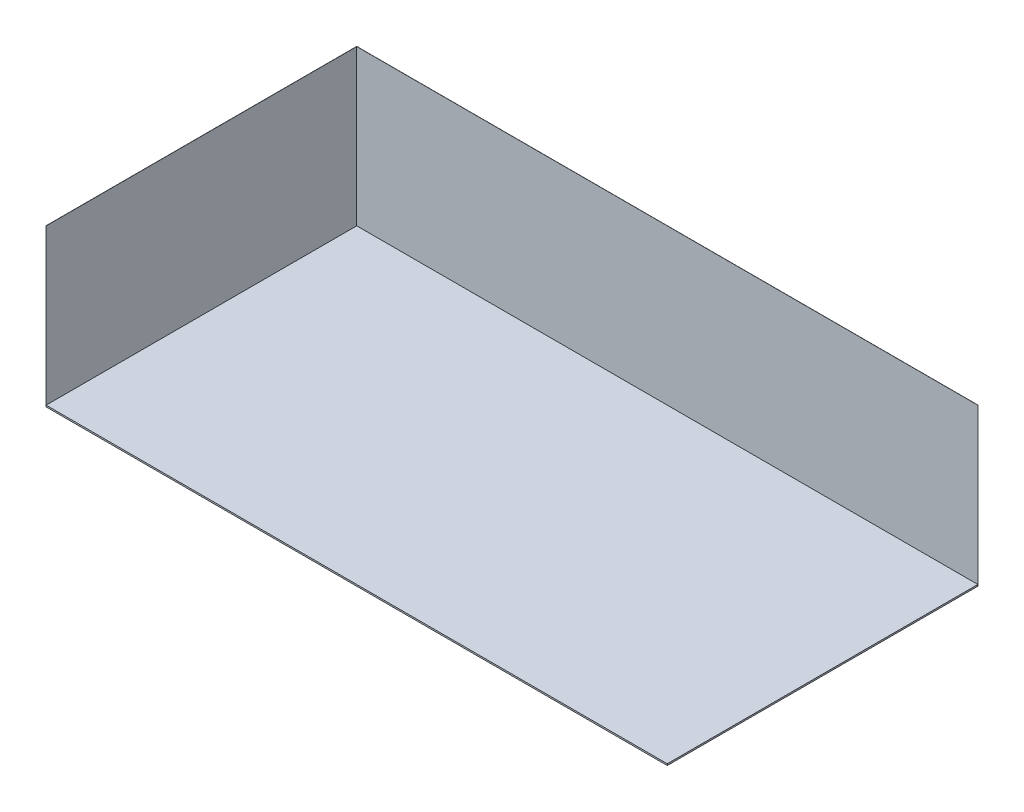
from build123d import *

# Parameters (mm, degrees)
SKETCH2_W     = 101.6
SKETCH2_H     = 50.8
FLOOR_2_DEPTH = 0.254
SKETCH3_W     = 101.6
SKETCH3_H     = 0.0254
WALL1_DEPTH   = 25.4
SKETCH4_W     = 0.0254
SKETCH4_H     = 50.8
WALL2_DEPTH   = 25.4


with BuildPart() as part:
    # Sketch2 → Floor 2 (new body)
    with BuildSketch(Plane(origin=(0, 0, 0), x_dir=(1, 0, 0), z_dir=(0, 1, 0))):
        with Locations((-2.520104439, -5.902349869)):
            Rectangle(SKETCH2_W, SKETCH2_H)
    extrude(amount=FLOOR_2_DEPTH)


with BuildPart() as body_2:
    # Sketch3 → Wall1 (new body)
    with BuildSketch(Plane(origin=(0, 0.254, 0), x_dir=(1, 0, 0), z_dir=(0, 1, 0))):
        with Locations((-2.520104439, 19.510350131)):
            Rectangle(SKETCH3_W, SKETCH3_H)
    extrude(amount=WALL1_DEPTH)


with BuildPart() as body_3:
    # Sketch4 → Wall2 (new body)
    with BuildSketch(Plane(origin=(0, 0.254, 0), x_dir=(1, 0, 0), z_dir=(0, 1, 0))):
        with Locations((-53.332804439, -5.902349869)):
            Rectangle(SKETCH4_W, SKETCH4_H)
    extrude(amount=WALL2_DEPTH)


solid = Compound([part.part, body_2.part, body_3.part])
